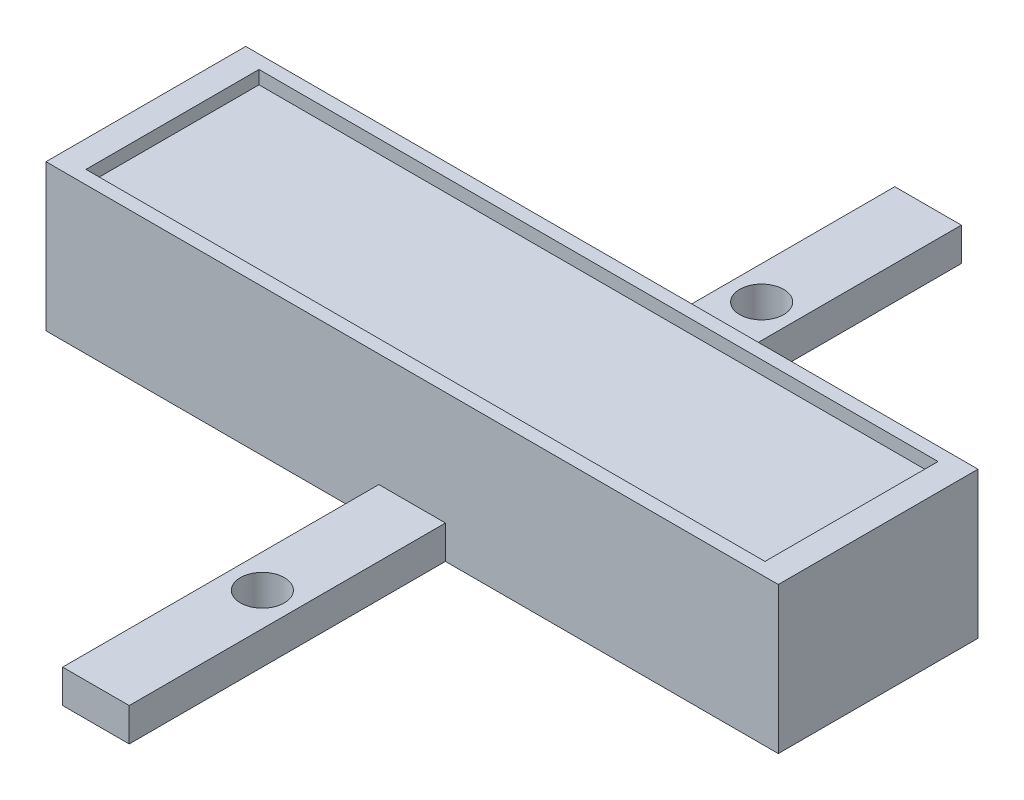
from build123d import *

# Parameters (mm, degrees)
SKETCH2_W           = 110
SKETCH2_H           = 30
BOSS_EXTRUDE1_DEPTH = 22
SKETCH3_W           = 102
SKETCH3_H           = 26
CUT_EXTRUDE1_DEPTH  = 2
SKETCH4_W           = 10
SKETCH4_H           = 47.5
BOSS_EXTRUDE3_DEPTH = 5
SKETCH7_W           = 3.3
SKETCH7_H           = 5
SKETCH13_W          = 10
SKETCH13_H          = 47.5
BOSS_EXTRUDE4_DEPTH = 5
SKETCH14_W          = 3.3
SKETCH14_H          = 5


with BuildPart() as part:
    # Sketch2 → Boss-Extrude1 (new body)
    with BuildSketch(Plane(origin=(0, 0, 0), x_dir=(1, 0, 0), z_dir=(0, 1, 0))):
        Rectangle(SKETCH2_W, SKETCH2_H)
    extrude(amount=BOSS_EXTRUDE1_DEPTH)

    # Sketch3 → Cut-Extrude1 (cut)
    with BuildSketch(Plane(origin=(0, 22, 0), x_dir=(1, 0, 0), z_dir=(0, 1, 0))):
        Rectangle(SKETCH3_W, SKETCH3_H)
    extrude(amount=-CUT_EXTRUDE1_DEPTH, mode=Mode.SUBTRACT)


with BuildPart() as body_2:
    # Sketch4 → Boss-Extrude3 (new body)
    with BuildSketch(Plane(origin=(0, 0, 0), x_dir=(-1, 0, 0), z_dir=(0, -1, 0))):
        with Locations((0, -38.75)):
            Rectangle(SKETCH4_W, SKETCH4_H)
    extrude(amount=-BOSS_EXTRUDE3_DEPTH)

    # Sketch7 → M6 Clearance Hole1 (revolve, cut)
    with BuildSketch(Plane(origin=(0, 5, 37.5), x_dir=(0, 0, 1), z_dir=(1, 0, 0))):
        with Locations((1.65, 2.5)):
            Rectangle(SKETCH7_W, SKETCH7_H)
    revolve(axis=Axis((0, 11.35, 37.5), (0, -1, 0)), mode=Mode.SUBTRACT)


with BuildPart() as body_3:
    # Sketch13 → Boss-Extrude4 (new body)
    with BuildSketch(Plane(origin=(0, 0, 0), x_dir=(-1, 0, 0), z_dir=(0, -1, 0))):
        with Locations((0, 38.75)):
            Rectangle(SKETCH13_W, SKETCH13_H)
    extrude(amount=-BOSS_EXTRUDE4_DEPTH)

    # Sketch14 → M6 Clearance Hole2 (revolve, cut)
    with BuildSketch(Plane(origin=(0, 5, -37.5), x_dir=(0, 0, 1), z_dir=(1, 0, 0))):
        with Locations((1.65, 2.5)):
            Rectangle(SKETCH14_W, SKETCH14_H)
    revolve(axis=Axis((0, 11.35, -37.5), (0, -1, 0)), mode=Mode.SUBTRACT)


solid = Compound([part.part, body_2.part, body_3.part])
